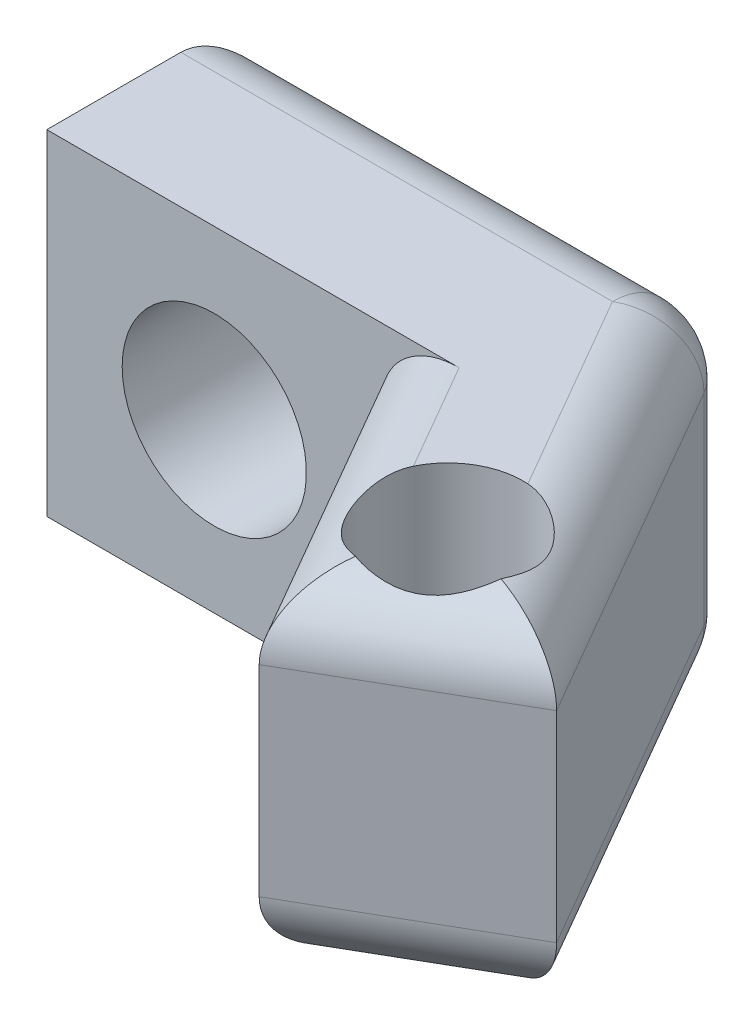
from build123d import *

# Parameters (mm, degrees)
EXTRUDE_1_DEPTH          = 10
CUT_EXTRUDE_1_DEPTH      = 29.347234569
CUT_EXTRUDE_1_DEPTH_BACK = 29.347234569
SKETCH_2_R               = 2.75
SKETCH_3_R               = 2.25
CUT_EXTRUDE_2_DEPTH      = 27.669152308
FILLET_1_R               = 2


with BuildPart() as part:
    # Эскиз1 → Бобышка-Вытянуть1 (new body)
    with BuildSketch(Plane(origin=(0, 0, 0), x_dir=(1, 0, 0), z_dir=(0, 1, 0))):
        Polygon((-22.105263158, 3.587719298), (-22.105263158, -2.412280702), (-12.105263158, -2.412280702), (-7.105263158, -11.07253474), (-1.476098033, -7.82253474), (-8.063811274, 3.587719298), align=None)
    extrude(amount=EXTRUDE_1_DEPTH)

    # Эскиз2 → Вырез-Вытянуть1 (cut, two sides: drawn at the far end of the back side and taken through both)
    with BuildSketch(Plane(origin=(0, 0, -3.587719298), x_dir=(-1, 0, 0), z_dir=(0, 0, -1)).offset(-CUT_EXTRUDE_1_DEPTH_BACK)):
        with Locations((17.105263158, 5)):
            Circle(SKETCH_2_R)
    extrude(amount=CUT_EXTRUDE_1_DEPTH + CUT_EXTRUDE_1_DEPTH_BACK, mode=Mode.SUBTRACT)

    # Эскиз3 → Вырез-Вытянуть2 (cut, through all)
    with BuildSketch(Plane.XZ):
        with Locations(Location((-5.915680596, 6.632952177, 0), (0, 0, 270))):
            Circle(SKETCH_3_R)
    extrude(amount=-CUT_EXTRUDE_2_DEPTH, mode=Mode.SUBTRACT)

    # Скругление1
    # the kernel refuses this fillet: 2 mm, written as the material it takes off along each edge
    with BuildSketch(Plane(origin=(-9.218511812, 2, -1.587719298), x_dir=(0.8660254037844398, 0, -0.499999999999998), z_dir=(0, -1, 0))) as fillet_1_piece_1_section:
        Polygon((0, 0), (FILLET_1_R, 0), (FILLET_1_R, -FILLET_1_R * 0.57735026919), (FILLET_1_R * 0.5, -FILLET_1_R * 0.866025403784), align=None)
    fillet_1_piece_1 = extrude(amount=FILLET_1_R, mode=Mode.PRIVATE)
    fillet_1_piece_1 = fillet_1_piece_1 - Plane(origin=(-9.218511812, 2, -1.587719298), x_dir=(-0.500000000000001, 0, 0.8660254037844382), z_dir=(0, -1, 0)) * Sphere(FILLET_1_R, mode=Mode.PRIVATE)
    add(fillet_1_piece_1, mode=Mode.SUBTRACT)
    with BuildSketch(Plane(origin=(-9.218511812, 8, -1.587719298), x_dir=(0.8660254037844398, 0, -0.499999999999998), z_dir=(0, 1, 0))) as fillet_1_piece_2_section:
        Polygon((0, 0), (FILLET_1_R, 0), (FILLET_1_R, FILLET_1_R * 0.57735026919), (FILLET_1_R * 0.5, FILLET_1_R * 0.866025403784), align=None)
    fillet_1_piece_2 = extrude(amount=FILLET_1_R, mode=Mode.PRIVATE)
    fillet_1_piece_2 = fillet_1_piece_2 - Plane(origin=(-9.218511812, 8, -1.587719298), x_dir=(-0.500000000000001, 0, 0.8660254037844382), z_dir=(0, 1, 0)) * Sphere(FILLET_1_R, mode=Mode.PRIVATE)
    add(fillet_1_piece_2, mode=Mode.SUBTRACT)
    with BuildSketch(Plane(origin=(-8.063811274, 2, -3.587719298), x_dir=(-1, 0, 0), z_dir=(0, 1, 0))) as fillet_1_piece_3:
        with BuildLine():
            CenterArc((FILLET_1_R * 0.57735026919, FILLET_1_R), FILLET_1_R, 210, 60)
            Line((-FILLET_1_R * 0.288675134595, FILLET_1_R * 0.5), (0, 0))
            Line((0, 0), (FILLET_1_R * 0.57735026919, 0))
        make_face()
    extrude(amount=6, mode=Mode.SUBTRACT)
    with BuildSketch(Plane(origin=(-22.105263158, -5, -3.587719298), x_dir=(0, 0, 1), z_dir=(0, 1, 0))) as fillet_1_piece_4:
        with BuildLine():
            CenterArc((FILLET_1_R, FILLET_1_R), FILLET_1_R, 180, 90)
            Line((0, FILLET_1_R), (0, 0))
            Line((0, 0), (FILLET_1_R, 0))
        make_face()
    extrude(amount=20, mode=Mode.SUBTRACT)
    with BuildSketch(Plane(origin=(-14.605263158, 10, -1.917846317), x_dir=(0.8660254037844399, 0, -0.4999999999999979), z_dir=(0.49999999999999795, 0, 0.8660254037844399))) as fillet_1_piece_5_section:
        with BuildLine():
            CenterArc((FILLET_1_R, -FILLET_1_R), FILLET_1_R, 90, 90)
            Line((0, -FILLET_1_R), (0, 0))
            Line((0, 0), (FILLET_1_R, 0))
        make_face()
    fillet_1_piece_5 = extrude(amount=20, mode=Mode.PRIVATE)
    fillet_1_piece_5 = split(fillet_1_piece_5, bisect_by=Plane(origin=(-7.90513861, 9.542907556, 2.412280702), z_dir=(0, 0, 1)), keep=Keep.TOP, mode=Mode.PRIVATE)
    add(fillet_1_piece_5, mode=Mode.SUBTRACT)
    with BuildSketch(Plane(origin=(-11.435390177, 10, 13.57253474), x_dir=(-0.4999999999999979, 0, -0.8660254037844399), z_dir=(0.8660254037844399, 0, -0.49999999999999795))) as fillet_1_piece_6:
        with BuildLine():
            CenterArc((FILLET_1_R, -FILLET_1_R), FILLET_1_R, 90, 90)
            Line((0, -FILLET_1_R), (0, 0))
            Line((0, 0), (FILLET_1_R, 0))
        make_face()
    extrude(amount=16.5, mode=Mode.SUBTRACT)
    with BuildSketch(Plane(origin=(1.023901967, 10, 12.152661759), x_dir=(-0.8660254037844398, 0, 0.499999999999998), z_dir=(-0.499999999999998, 0, -0.8660254037844398))) as fillet_1_piece_7:
        with BuildLine():
            CenterArc((FILLET_1_R, -FILLET_1_R), FILLET_1_R, 90, 90)
            Line((0, -FILLET_1_R), (0, 0))
            Line((0, 0), (FILLET_1_R, 0))
        make_face()
    extrude(amount=17.020725942, mode=Mode.SUBTRACT)
    with BuildSketch(Plane(origin=(-9.218511812, 10, -3.587719298), x_dir=(0, -1, 0), z_dir=(-1, 0, 0))) as fillet_1_piece_8:
        with BuildLine():
            CenterArc((FILLET_1_R, FILLET_1_R), FILLET_1_R, 180, 90)
            Line((0, FILLET_1_R), (0, 0))
            Line((0, 0), (FILLET_1_R, 0))
        make_face()
    extrude(amount=17.886751346, mode=Mode.SUBTRACT)
    with BuildSketch(Plane(origin=(1.023901967, 0, 12.152661759), x_dir=(-0.8660254037844398, 0, 0.499999999999998), z_dir=(-0.499999999999998, 0, -0.8660254037844398))) as fillet_1_piece_9:
        with BuildLine():
            CenterArc((FILLET_1_R, FILLET_1_R), FILLET_1_R, 180, 90)
            Line((0, FILLET_1_R), (0, 0))
            Line((0, 0), (FILLET_1_R, 0))
        make_face()
    extrude(amount=17.020725942, mode=Mode.SUBTRACT)
    with BuildSketch(Plane(origin=(-11.435390177, 0, 13.57253474), x_dir=(-0.4999999999999979, 0, -0.8660254037844399), z_dir=(0.8660254037844399, 0, -0.49999999999999795))) as fillet_1_piece_10:
        with BuildLine():
            CenterArc((FILLET_1_R, FILLET_1_R), FILLET_1_R, 180, 90)
            Line((0, FILLET_1_R), (0, 0))
            Line((0, 0), (FILLET_1_R, 0))
        make_face()
    extrude(amount=16.5, mode=Mode.SUBTRACT)
    with BuildSketch(Plane(origin=(-14.605263158, 0, -1.917846317), x_dir=(0.8660254037844398, 0, -0.4999999999999979), z_dir=(0.49999999999999795, 0, 0.8660254037844399))) as fillet_1_piece_11_section:
        with BuildLine():
            CenterArc((FILLET_1_R, FILLET_1_R), FILLET_1_R, 180, 90)
            Line((0, FILLET_1_R), (0, 0))
            Line((0, 0), (FILLET_1_R, 0))
        make_face()
    fillet_1_piece_11 = extrude(amount=20, mode=Mode.PRIVATE)
    fillet_1_piece_11 = split(fillet_1_piece_11, bisect_by=Plane(origin=(-7.90513861, 0.457092444, 2.412280702), z_dir=(0, 0, 1)), keep=Keep.TOP, mode=Mode.PRIVATE)
    add(fillet_1_piece_11, mode=Mode.SUBTRACT)
    with BuildSketch(Plane(origin=(-9.218511812, 0, -3.587719298), x_dir=(0, 1, 0), z_dir=(-1, 0, 0))) as fillet_1_piece_12:
        with BuildLine():
            CenterArc((FILLET_1_R, -FILLET_1_R), FILLET_1_R, 90, 90)
            Line((0, -FILLET_1_R), (0, 0))
            Line((0, 0), (FILLET_1_R, 0))
        make_face()
    extrude(amount=17.886751346, mode=Mode.SUBTRACT)


solid = part.part
